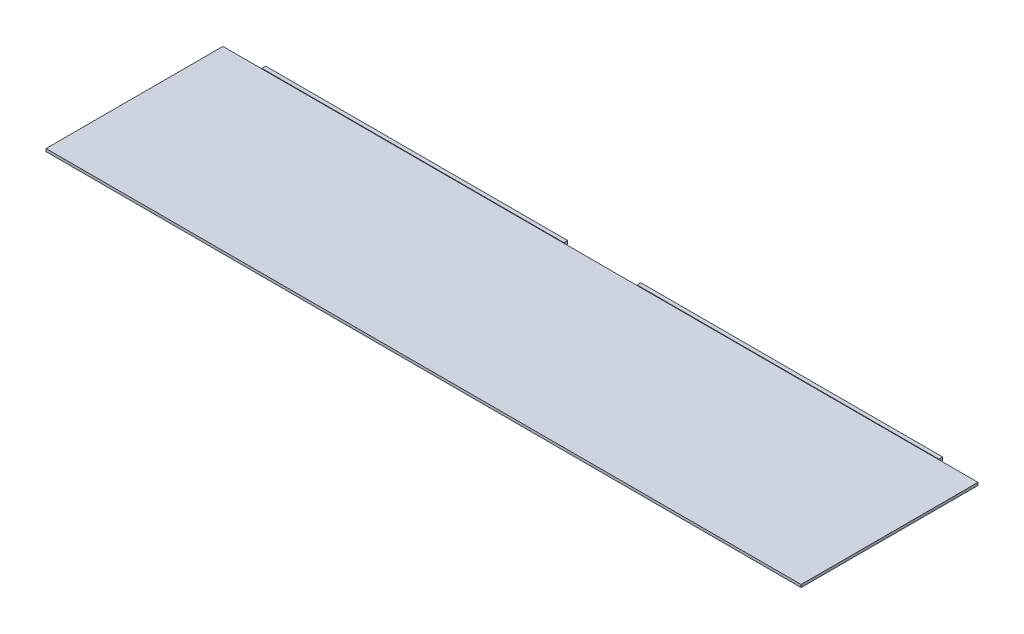
from build123d import *

# Parameters (mm, degrees)
SKETCH1_W           = 635.3556
SKETCH1_H           = 148.844
BOSS_EXTRUDE1_DEPTH = 1.143
SKETCH2_W           = 254
SKETCH2_H           = 2.7305
BOSS_EXTRUDE2_DEPTH = 3.175


with BuildPart() as part:
    # Sketch1 → Boss-Extrude1 (new, symmetric)
    with BuildSketch(Plane(origin=(0, 0, 0), x_dir=(1, 0, 0), z_dir=(0, 1, 0))):
        Rectangle(SKETCH1_W, SKETCH1_H)
    extrude(amount=BOSS_EXTRUDE1_DEPTH, both=True)

    # Sketch2 → Boss-Extrude2 (add)
    with BuildSketch(Plane(origin=(0, 0, -74.422), x_dir=(-1, 0, 0), z_dir=(0, 0, -1))):
        with Locations((-157.8229, 0.22225)):
            Rectangle(SKETCH2_W, SKETCH2_H)
        with Locations((157.8229, 0.22225)):
            Rectangle(SKETCH2_W, SKETCH2_H)
    extrude(amount=BOSS_EXTRUDE2_DEPTH)


solid = part.part
